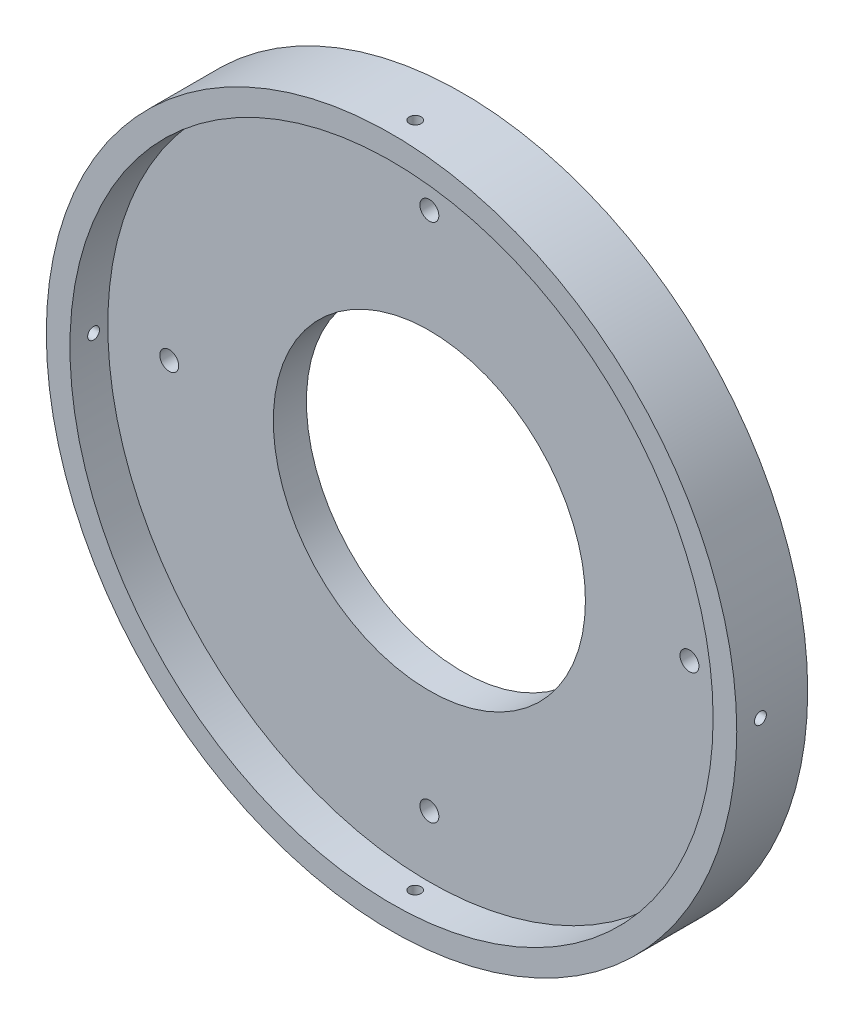
from build123d import *

# Parameters (mm, degrees)
SKETCH1_R               = 73
SKETCH1_R_2             = 33
BOSS_EXTRUDE1_DEPTH     = 7
SKETCH2_R               = 73
SKETCH2_R_2             = 68
BOSS_EXTRUDE2_DEPTH     = 8
CUT_EXTRUDE1_REACH      = 106.322
CUT_EXTRUDE1_END_RADIUS = 73
SKETCH3_R               = 1.25
CIRPATTERN1_COUNT       = 4
F_4_0MM_DOWEL_HOLE1_D   = 4
CUT_EXTRUDE2_DEPTH      = 3.2


with BuildPart() as part:
    # Sketch1 → Boss-Extrude1 (new body)
    with BuildSketch(Plane.XY):
        Circle(SKETCH1_R)
        Circle(SKETCH1_R_2, mode=Mode.SUBTRACT)
    extrude(amount=BOSS_EXTRUDE1_DEPTH)

    # Sketch2 → Boss-Extrude2 (add)
    with BuildSketch(Plane.XY.offset(7)):
        Circle(SKETCH2_R)
        Circle(SKETCH2_R_2, mode=Mode.SUBTRACT)
    extrude(amount=BOSS_EXTRUDE2_DEPTH)

    # Cut-Extrude1: up to this cylinder (the profile starts inside it)
    cut_extrude1_end = Plane(origin=(0, 0, 10), z_dir=(0, 0, -1)) * Cylinder(CUT_EXTRUDE1_END_RADIUS, 359.644, mode=Mode.PRIVATE)
    # Sketch3 → Cut-Extrude1 (cut, up to the surface)
    with BuildSketch(Plane(origin=(0, 0, 0), x_dir=(1, 0, 0), z_dir=(0, 1, 0)), mode=Mode.PRIVATE) as cut_extrude1_sk1:
        with Locations((0, -10)):
            Circle(SKETCH3_R)
    cut_extrude1_tool1 = extrude(cut_extrude1_sk1.sketch, amount=-CUT_EXTRUDE1_REACH, mode=Mode.PRIVATE) & cut_extrude1_end
    cut_extrude1 = cut_extrude1_tool1.solids().sort_by_distance((0, 0, 10))[0]
    add(cut_extrude1, mode=Mode.SUBTRACT)

    # CirPattern1: Cut-Extrude1 ×4 about axis
    cirpattern1_axis = Axis((0, 0, 7), (0, 0, -1))
    for i in range(1, CIRPATTERN1_COUNT):
        add(cut_extrude1.rotate(cirpattern1_axis, i * 360 / CIRPATTERN1_COUNT), mode=Mode.SUBTRACT)

    # Ø4.0mm Dowel Hole1 (through all)
    with Locations(Plane(origin=(0, 0, 0), x_dir=(-1, 0, 0), z_dir=(0, 0, -1))):
        with Locations((0, 55), (55, 0), (0, -55), (-55, 0)):
            Hole(F_4_0MM_DOWEL_HOLE1_D / 2)

    # Sketch13 → Cut-Extrude2 (cut)
    with BuildSketch(Plane(origin=(0, 0, 0), x_dir=(-1, 0, 0), z_dir=(0, 0, -1))):
        Polygon((4.041451884, 55), (2.020725942, 58.5), (-2.020725942, 58.5), (-4.041451884, 55), (-2.020725942, 51.5), (2.020725942, 51.5), align=None)
        Polygon((55, -4.041451884), (58.5, -2.020725942), (58.5, 2.020725942), (55, 4.041451884), (51.5, 2.020725942), (51.5, -2.020725942), align=None)
        Polygon((-4.041451884, -55), (-2.020725942, -58.5), (2.020725942, -58.5), (4.041451884, -55), (2.020725942, -51.5), (-2.020725942, -51.5), align=None)
        Polygon((-55, 4.041451884), (-58.5, 2.020725942), (-58.5, -2.020725942), (-55, -4.041451884), (-51.5, -2.020725942), (-51.5, 2.020725942), align=None)
    extrude(amount=-CUT_EXTRUDE2_DEPTH, mode=Mode.SUBTRACT)


solid = part.part
